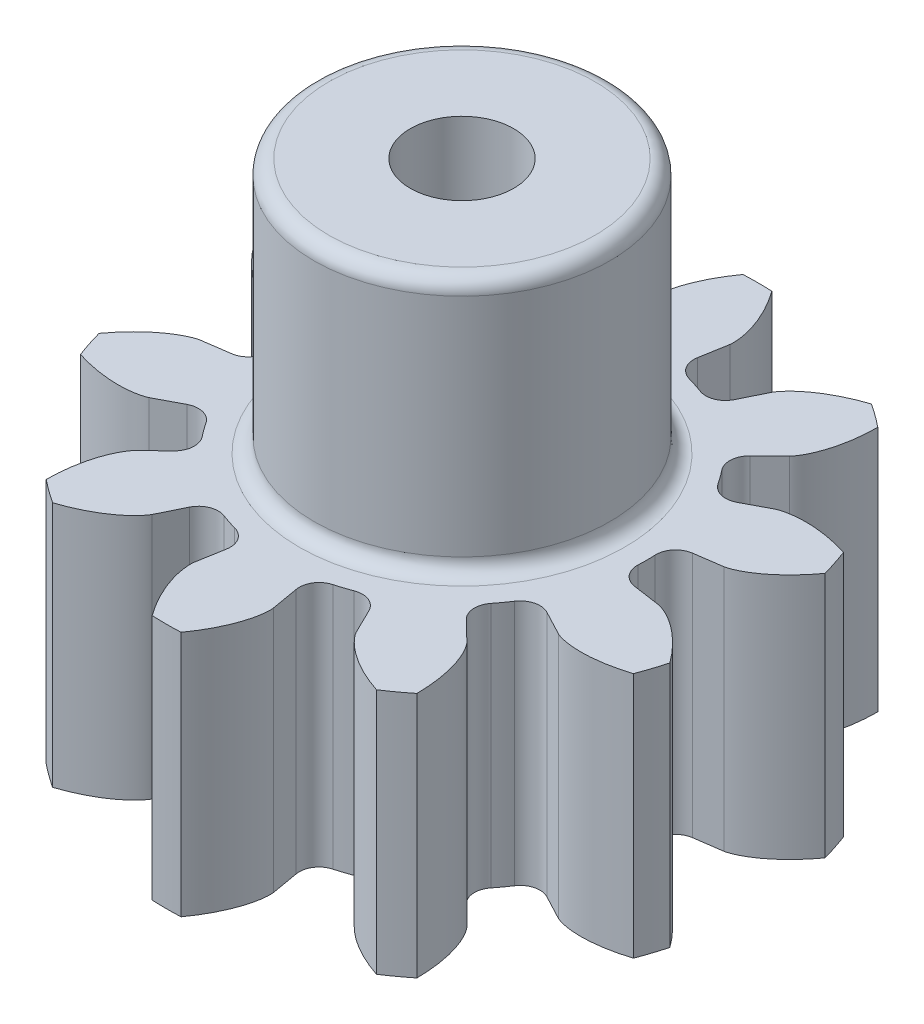
from build123d import *

# Parameters (mm, degrees)
SKETCH2_R                = 15.24
BOSS_EXTRUDE1_DEPTH      = 12.7
CUT_EXTRUDE1_DEPTH       = 26.016098817
FILLET1_R                = 1.016
CIRPATTERN1_COUNT        = 10
FILLET1_OF_CIRPATTERN1_R = 1.016
SKETCH4_R                = 7.62
BOSS_EXTRUDE2_DEPTH      = 13.16
SKETCH5_R                = 2.667
CUT_EXTRUDE2_DEPTH       = 34.426056363
FILLET2_R                = 0.762


with BuildPart() as part:
    # Sketch2 → Boss-Extrude1 (new body)
    with BuildSketch(Plane(origin=(0, 0, 0), x_dir=(1, 0, 0), z_dir=(0, 1, 0))):
        Circle(SKETCH2_R)
    extrude(amount=BOSS_EXTRUDE1_DEPTH)

    # Sketch3 → Cut-Extrude1 (cut, through all)
    with BuildSketch(Plane(origin=(0, 0, 0), x_dir=(-1, 0, 0), z_dir=(0, -1, 0))):
        with BuildLine():
            Line((9.428893824, -1.349661534), (11.813682598, -1.691022645))
            add(Edge.make_bspline(
                [(11.813682598, -1.691022645), (11.819178365, -1.691903787), (11.834545167, -1.694660871), (11.863400401, -1.700999964), (11.910150555, -1.712933326), (11.969184939, -1.730464153), (12.04479756, -1.755773638), (12.132910439, -1.7889748), (12.228645625, -1.82897949), (12.331522072, -1.876262838), (12.432952776, -1.926731697), (12.532947922, -1.980115008), (12.631445021, -2.036015147), (12.749370299, -2.106907896), (12.888801103, -2.196315459), (13.048717462, -2.307123688), (13.226338861, -2.440160727), (13.403109396, -2.583451627), (13.573472712, -2.730730451), (13.741256687, -2.886575073), (13.90049908, -3.042342342), (14.06117781, -3.211114463), (14.207107268, -3.370471575), (14.365124352, -3.556498071), (14.491066541, -3.708832868), (14.616438915, -3.872275149), (14.676753563, -3.95271226), (14.707278225, -3.994191683)],
                knots=[0, 0, 0, 0, 0, 0.005376749, 0.015083688, 0.02853182, 0.046610139, 0.064854849, 0.092110525, 0.119476176, 0.146842496, 0.174208854, 0.201574956, 0.228941013, 0.256307345, 0.307035032, 0.361767352, 0.41649966, 0.471231936, 0.525964282, 0.580696615, 0.635428982, 0.690161387, 0.744893688, 0.799626082, 0.854358408, 0.909090915, 0.909090915, 0.909090915, 0.909090915, 0.909090915], degree=4))
            ThreePointArc((14.707278225, -3.994191683), (15.24, 0), (14.707278225, 3.994191683))
            add(Edge.make_bspline(
                [(14.707278225, 3.994191683), (14.676753563, 3.95271226), (14.616438915, 3.872275149), (14.491066541, 3.708832868), (14.365124352, 3.556498071), (14.207107268, 3.370471575), (14.06117781, 3.211114463), (13.90049908, 3.042342342), (13.741256687, 2.886575073), (13.573472712, 2.730730451), (13.403109396, 2.583451627), (13.226338861, 2.440160727), (13.048717462, 2.307123688), (12.888801103, 2.196315459), (12.749370299, 2.106907896), (12.631445021, 2.036015147), (12.532947922, 1.980115008), (12.432952776, 1.926731697), (12.331522072, 1.876262838), (12.228645625, 1.82897949), (12.132910439, 1.7889748), (12.04479756, 1.755773638), (11.969184939, 1.730464153), (11.910150555, 1.712933326), (11.863400401, 1.700999964), (11.834545167, 1.694660871), (11.819178365, 1.691903787), (11.813682598, 1.691022645)],
                knots=[0.190928826, 0.190928826, 0.190928826, 0.190928826, 0.190928826, 0.245661333, 0.300393658, 0.355126053, 0.409858354, 0.464590759, 0.519323125, 0.574055459, 0.628787804, 0.68352008, 0.738252389, 0.792984709, 0.843712396, 0.871078728, 0.898444785, 0.925810887, 0.953177245, 0.980543565, 1.007909216, 1.035164892, 1.053409601, 1.071487921, 1.084936053, 1.094642992, 1.100019741, 1.100019741, 1.100019741, 1.100019741, 1.100019741], degree=4))
            Line((11.813682598, 1.691022645), (9.428893824, 1.349661534))
            ThreePointArc((9.428893824, 1.349661534), (9.525, 0), (9.428893824, -1.349661534))
        make_face()
    cut_extrude1 = extrude(amount=-CUT_EXTRUDE1_DEPTH, mode=Mode.SUBTRACT)

    # Fillet1
    fillet1_edges = [part.edges().sort_by_distance(p)[0] for p in [
        (-9.428893824, 6.35, -1.349661534),
        (-9.428893824, 6.35, 1.349661534),
    ]]
    fillet(fillet1_edges, radius=FILLET1_R)

    # CirPattern1: Cut-Extrude1 ×10 about axis
    cirpattern1_axis = Axis((0, 0, 0), (0, 1, 0))
    for i in range(1, CIRPATTERN1_COUNT):
        add(cut_extrude1.rotate(cirpattern1_axis, i * 360 / CIRPATTERN1_COUNT), mode=Mode.SUBTRACT)

    # Fillet1 of CirPattern1
    fillet1_of_cirpattern1_edges = [part.edges().sort_by_distance(p)[0] for p in [
        (-8.421446487, 6.35, 4.450265617),
        (-6.834824196, 6.35, 6.634063853),
        (-4.197292826, 6.35, 8.550342562),
        (-1.630084033, 6.35, 9.384479263),
        (1.630084033, 6.35, 9.384479263),
        (4.197292826, 6.35, 8.550342562),
        (6.834824196, 6.35, 6.634063853),
        (8.421446487, 6.35, 4.450265617),
        (9.428893824, 6.35, 1.349661534),
        (9.428893824, 6.35, -1.349661534),
        (8.421446487, 6.35, -4.450265617),
        (6.834824196, 6.35, -6.634063853),
        (4.197292826, 6.35, -8.550342562),
        (1.630084033, 6.35, -9.384479263),
        (-1.630084033, 6.35, -9.384479263),
        (-4.197292826, 6.35, -8.550342562),
        (-6.834824196, 6.35, -6.634063853),
        (-8.421446487, 6.35, -4.450265617),
    ]]
    fillet(fillet1_of_cirpattern1_edges, radius=FILLET1_OF_CIRPATTERN1_R)

    # Sketch4 → Boss-Extrude2 (add)
    with BuildSketch(Plane(origin=(0, 12.7, 0), x_dir=(1, 0, 0), z_dir=(0, 1, 0))):
        Circle(SKETCH4_R)
    extrude(amount=BOSS_EXTRUDE2_DEPTH)

    # Sketch5 → Cut-Extrude2 (cut, through all)
    with BuildSketch(Plane(origin=(0, 25.86, 0), x_dir=(1, 0, 0), z_dir=(0, 1, 0))):
        Circle(SKETCH5_R)
    extrude(amount=-CUT_EXTRUDE2_DEPTH, mode=Mode.SUBTRACT)

    # Fillet2
    fillet2_edges = [part.edges().sort_by_distance(p)[0] for p in [
        (-7.62, 25.86, 0),
        (-7.62, 12.7, 0),
    ]]
    fillet(fillet2_edges, radius=FILLET2_R)


solid = part.part
